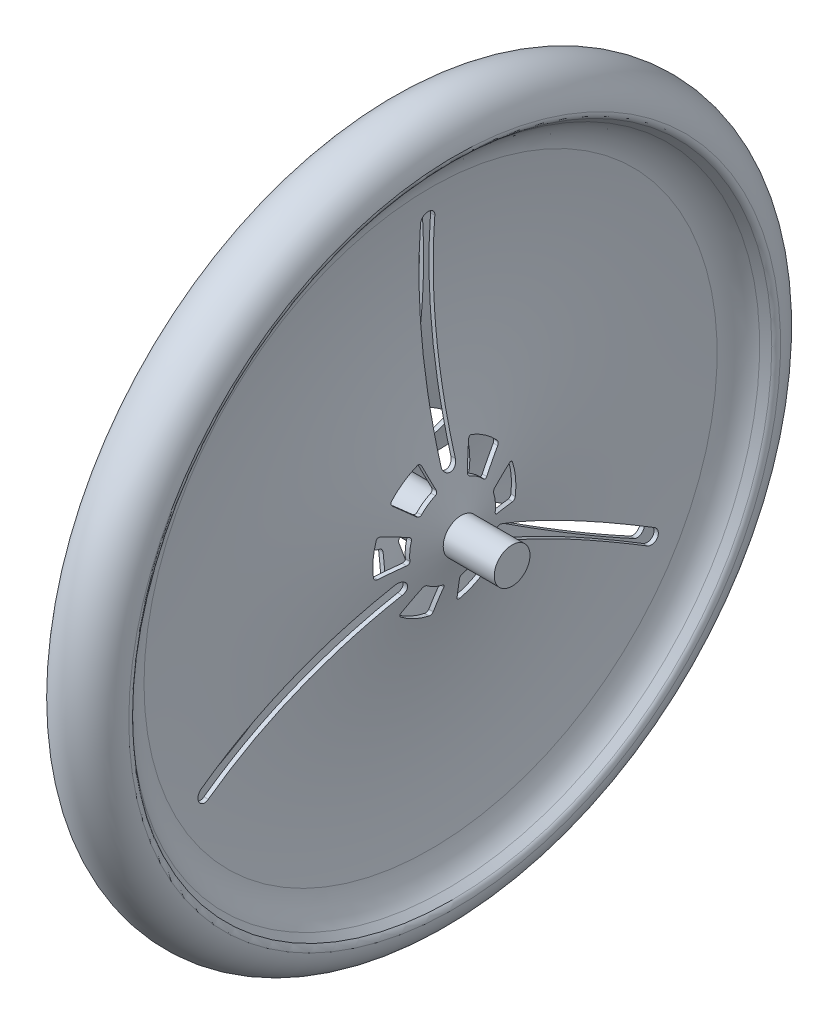
from build123d import *

# Parameters (mm, degrees)
SHELL2_T                       = 3
CUT_EXTRUDE1_REACH             = 356.77
CUT_EXTRUDE1_DIRECTION_2_REACH = 356.77
SKETCH3_R                      = 12.5
BOSS_EXTRUDE1_DEPTH            = 65


with BuildPart() as part:
    # Sketch1 → Revolve1 (revolve)
    with BuildSketch(Plane.XY):
        with BuildLine():
            Line((23.089545139, 223.396938031), (18.4881994, 219.535950518))
            ThreePointArc((18.4881994, 219.535950518), (11.430058579, 210.911190634), (8.007194137, 200.305162445))
            ThreePointArc((8.007194137, 200.305162445), (7.428056518, 105.123603262), (29.353674586, 12.5))
            Line((29.353674586, 12.5), (-29.353674586, 12.5))
            ThreePointArc((-29.353674586, 12.5), (-7.428056518, 105.123603262), (-8.007194137, 200.305162445))
            ThreePointArc((-8.007194137, 200.305162445), (-11.430058579, 210.911190634), (-18.4881994, 219.535950518))
            Line((-18.4881994, 219.535950518), (-23.089545139, 223.396938031))
            ThreePointArc((-23.089545139, 223.396938031), (-24.517932593, 225.37006199), (-24.844508864, 227.783950308))
            ThreePointArc((-24.844508864, 227.783950308), (0, 250), (24.844508864, 227.783950308))
            ThreePointArc((24.844508864, 227.783950308), (24.517932593, 225.37006199), (23.089545139, 223.396938031))
        make_face()
    revolve(axis=Axis((0, 0, 0), (1, 0, 0)))

    # Shell2 (no face opened: a closed hollow body)
    add(offset(amount=-SHELL2_T, mode=Mode.PRIVATE), mode=Mode.SUBTRACT)

    # Sketch2 → Cut-Extrude1 (cut, up to next)
    with BuildSketch(Plane(origin=(0, 0, 0), x_dir=(0, 0, -1), z_dir=(1, 0, 0)), mode=Mode.PRIVATE) as cut_extrude1_sk1:
        with BuildLine():
            Line((-5, 40), (-5, 180))
            ThreePointArc((-5, 180), (0, 185), (5, 180))
            Line((5, 180), (5, 40))
            ThreePointArc((5, 40), (0, 35), (-5, 40))
        make_face()
    cut_extrude1_tool1 = extrude(cut_extrude1_sk1.sketch, amount=CUT_EXTRUDE1_REACH, mode=Mode.PRIVATE) & part.part
    # Sketch2 → Cut-Extrude1 (cut, up to next)
    with BuildSketch(Plane(origin=(0, 0, 0), x_dir=(0, 0, -1), z_dir=(1, 0, 0)), mode=Mode.PRIVATE) as cut_extrude1_sk2:
        with BuildLine():
            Line((32.141016151, -24.330127019), (153.384572681, -94.330127019))
            ThreePointArc((153.384572681, -94.330127019), (160.2146997, -92.5), (158.384572681, -85.669872981))
            Line((158.384572681, -85.669872981), (37.141016151, -15.669872981))
            ThreePointArc((37.141016151, -15.669872981), (30.310889132, -17.5), (32.141016151, -24.330127019))
        make_face()
    cut_extrude1_tool2 = extrude(cut_extrude1_sk2.sketch, amount=CUT_EXTRUDE1_REACH, mode=Mode.PRIVATE) & part.part
    # Sketch2 → Cut-Extrude1 (cut, up to next)
    with BuildSketch(Plane(origin=(0, 0, 0), x_dir=(0, 0, -1), z_dir=(1, 0, 0)), mode=Mode.PRIVATE) as cut_extrude1_sk3:
        with BuildLine():
            Line((-37.141016151, -15.669872981), (-158.384572681, -85.669872981))
            ThreePointArc((-158.384572681, -85.669872981), (-160.2146997, -92.5), (-153.384572681, -94.330127019))
            Line((-153.384572681, -94.330127019), (-32.141016151, -24.330127019))
            ThreePointArc((-32.141016151, -24.330127019), (-30.310889132, -17.5), (-37.141016151, -15.669872981))
        make_face()
    cut_extrude1_tool3 = extrude(cut_extrude1_sk3.sketch, amount=CUT_EXTRUDE1_REACH, mode=Mode.PRIVATE) & part.part
    # Sketch2 → Cut-Extrude1 (cut, up to next)
    with BuildSketch(Plane(origin=(0, 0, 0), x_dir=(0, 0, -1), z_dir=(1, 0, 0)), mode=Mode.PRIVATE) as cut_extrude1_sk4:
        with BuildLine():
            Line((10.923247411, 30.01137561), (16.40270985, 45.06607493))
            ThreePointArc((16.40270985, 45.06607493), (17.474813121, 46.21186956), (19.043849053, 46.231286087))
            ThreePointArc((19.043849053, 46.231286087), (28.678821818, 40.957602214), (36.929818402, 33.70739552))
            ThreePointArc((36.929818402, 33.70739552), (37.448214729, 32.22634319), (36.738200886, 30.827010813))
            Line((36.738200886, 30.827010813), (24.465497555, 20.528989975))
            ThreePointArc((24.465497555, 20.528989975), (23.067988689, 20.064213603), (21.73117719, 20.682261432))
            ThreePointArc((21.73117719, 20.682261432), (17.207293091, 24.574561329), (12.002468112, 27.494376865))
            ThreePointArc((12.002468112, 27.494376865), (10.964476667, 28.53918396), (10.923247411, 30.01137561))
        make_face()
    cut_extrude1_tool4 = extrude(cut_extrude1_sk4.sketch, amount=CUT_EXTRUDE1_REACH, mode=Mode.PRIVATE) & part.part
    # Sketch2 → Cut-Extrude1 (cut, up to next)
    with BuildSketch(Plane(origin=(0, 0, 0), x_dir=(0, 0, -1), z_dir=(1, 0, 0)), mode=Mode.PRIVATE) as cut_extrude1_sk5:
        with BuildLine():
            Line((31.452237386, -5.545878055), (47.229720663, -8.327874044))
            ThreePointArc((47.229720663, -8.327874044), (48.758059556, -7.97230269), (49.559392727, -6.623185977))
            ThreePointArc((49.559392727, -6.623185977), (49.809734905, 4.357787137), (47.656370017, 15.128463133))
            ThreePointArc((47.656370017, 15.128463133), (46.632939238, 16.317933687), (45.06607493, 16.40270985))
            Line((45.06607493, 16.40270985), (30.01137561, 10.923247411))
            ThreePointArc((30.01137561, 10.923247411), (28.910113032, 9.945357418), (28.776952403, 8.478620784))
            ThreePointArc((28.776952403, 8.478620784), (29.885840943, 2.614672282), (29.812062883, -3.35274614))
            ThreePointArc((29.812062883, -3.35274614), (30.197896646, -4.774076647), (31.452237386, -5.545878055))
        make_face()
    cut_extrude1_tool5 = extrude(cut_extrude1_sk5.sketch, amount=CUT_EXTRUDE1_REACH, mode=Mode.PRIVATE) & part.part
    # Sketch2 → Cut-Extrude1 (cut, up to next)
    with BuildSketch(Plane(origin=(0, 0, 0), x_dir=(0, 0, -1), z_dir=(1, 0, 0)), mode=Mode.PRIVATE) as cut_extrude1_sk6:
        with BuildLine():
            Line((5.545878055, -31.452237386), (8.327874044, -47.229720663))
            ThreePointArc((8.327874044, -47.229720663), (9.184724509, -48.544276877), (10.726551615, -48.835858654))
            ThreePointArc((10.726551615, -48.835858654), (21.130913087, -45.315389352), (30.515543674, -39.608100109))
            ThreePointArc((30.515543674, -39.608100109), (31.283246434, -38.239566869), (30.827010813, -36.738200886))
            Line((30.827010813, -36.738200886), (20.528989975, -24.465497555))
            ThreePointArc((20.528989975, -24.465497555), (19.233419979, -23.765107313), (17.809594771, -24.141630726))
            ThreePointArc((17.809594771, -24.141630726), (12.678547852, -27.189233611), (7.045775213, -29.160882216))
            ThreePointArc((7.045775213, -29.160882216), (5.842124343, -30.009571021), (5.545878055, -31.452237386))
        make_face()
    cut_extrude1_tool6 = extrude(cut_extrude1_sk6.sketch, amount=CUT_EXTRUDE1_REACH, mode=Mode.PRIVATE) & part.part
    # Sketch2 → Cut-Extrude1 (cut, up to next)
    with BuildSketch(Plane(origin=(0, 0, 0), x_dir=(0, 0, -1), z_dir=(1, 0, 0)), mode=Mode.PRIVATE) as cut_extrude1_sk7:
        with BuildLine():
            Line((-20.528989975, -24.465497555), (-30.827010813, -36.738200886))
            ThreePointArc((-30.827010813, -36.738200886), (-31.283246434, -38.239566869), (-30.515543674, -39.608100109))
            ThreePointArc((-30.515543674, -39.608100109), (-21.130913087, -45.315389352), (-10.726551615, -48.835858654))
            ThreePointArc((-10.726551615, -48.835858654), (-9.184724509, -48.544276877), (-8.327874044, -47.229720663))
            Line((-8.327874044, -47.229720663), (-5.545878055, -31.452237386))
            ThreePointArc((-5.545878055, -31.452237386), (-5.842124343, -30.009571021), (-7.045775213, -29.160882216))
            ThreePointArc((-7.045775213, -29.160882216), (-12.678547852, -27.189233611), (-17.809594771, -24.141630726))
            ThreePointArc((-17.809594771, -24.141630726), (-19.233419979, -23.765107313), (-20.528989975, -24.465497555))
        make_face()
    cut_extrude1_tool7 = extrude(cut_extrude1_sk7.sketch, amount=CUT_EXTRUDE1_REACH, mode=Mode.PRIVATE) & part.part
    # Sketch2 → Cut-Extrude1 (cut, up to next)
    with BuildSketch(Plane(origin=(0, 0, 0), x_dir=(0, 0, -1), z_dir=(1, 0, 0)), mode=Mode.PRIVATE) as cut_extrude1_sk8:
        with BuildLine():
            Line((-30.01137561, 10.923247411), (-45.06607493, 16.40270985))
            ThreePointArc((-45.06607493, 16.40270985), (-46.632939238, 16.317933687), (-47.656370017, 15.128463133))
            ThreePointArc((-47.656370017, 15.128463133), (-49.809734905, 4.357787137), (-49.559392727, -6.623185977))
            ThreePointArc((-49.559392727, -6.623185977), (-48.758059556, -7.97230269), (-47.229720663, -8.327874044))
            Line((-47.229720663, -8.327874044), (-31.452237386, -5.545878055))
            ThreePointArc((-31.452237386, -5.545878055), (-30.197896646, -4.774076647), (-29.812062883, -3.35274614))
            ThreePointArc((-29.812062883, -3.35274614), (-29.885840943, 2.614672282), (-28.776952403, 8.478620784))
            ThreePointArc((-28.776952403, 8.478620784), (-28.910113032, 9.945357418), (-30.01137561, 10.923247411))
        make_face()
    cut_extrude1_tool8 = extrude(cut_extrude1_sk8.sketch, amount=CUT_EXTRUDE1_REACH, mode=Mode.PRIVATE) & part.part
    # Sketch2 → Cut-Extrude1 (cut, up to next)
    with BuildSketch(Plane(origin=(0, 0, 0), x_dir=(0, 0, -1), z_dir=(1, 0, 0)), mode=Mode.PRIVATE) as cut_extrude1_sk9:
        with BuildLine():
            Line((-10.923247411, 30.01137561), (-16.40270985, 45.06607493))
            ThreePointArc((-16.40270985, 45.06607493), (-17.474813121, 46.21186956), (-19.043849053, 46.231286087))
            ThreePointArc((-19.043849053, 46.231286087), (-28.678821818, 40.957602214), (-36.929818402, 33.70739552))
            ThreePointArc((-36.929818402, 33.70739552), (-37.448214729, 32.22634319), (-36.738200886, 30.827010813))
            Line((-36.738200886, 30.827010813), (-24.465497555, 20.528989975))
            ThreePointArc((-24.465497555, 20.528989975), (-23.067988689, 20.064213603), (-21.73117719, 20.682261432))
            ThreePointArc((-21.73117719, 20.682261432), (-17.207293091, 24.574561329), (-12.002468112, 27.494376865))
            ThreePointArc((-12.002468112, 27.494376865), (-10.964476667, 28.53918396), (-10.923247411, 30.01137561))
        make_face()
    cut_extrude1_tool9 = extrude(cut_extrude1_sk9.sketch, amount=CUT_EXTRUDE1_REACH, mode=Mode.PRIVATE) & part.part
    add(cut_extrude1_tool1.solids().sort_by_distance((0, 110, 0))[0], mode=Mode.SUBTRACT)
    add(cut_extrude1_tool2.solids().sort_by_distance((0, -55, -95.262794))[0], mode=Mode.SUBTRACT)
    add(cut_extrude1_tool3.solids().sort_by_distance((0, -55, 95.262794))[0], mode=Mode.SUBTRACT)
    add(cut_extrude1_tool4.solids().sort_by_distance((0, 33.073811, -23.158532))[0], mode=Mode.SUBTRACT)
    add(cut_extrude1_tool5.solids().sort_by_distance((0, 3.518971, -40.222026))[0], mode=Mode.SUBTRACT)
    add(cut_extrude1_tool6.solids().sort_by_distance((0, -36.592782, -17.063495))[0], mode=Mode.SUBTRACT)
    add(cut_extrude1_tool7.solids().sort_by_distance((0, -36.592782, 17.063495))[0], mode=Mode.SUBTRACT)
    add(cut_extrude1_tool8.solids().sort_by_distance((0, 3.518971, 40.222026))[0], mode=Mode.SUBTRACT)
    add(cut_extrude1_tool9.solids().sort_by_distance((0, 33.073811, 23.158532))[0], mode=Mode.SUBTRACT)

    # Sketch2 → Cut-Extrude1 direction 2 (cut, up to next)
    with BuildSketch(Plane(origin=(0, 0, 0), x_dir=(0, 0, -1), z_dir=(1, 0, 0)), mode=Mode.PRIVATE) as cut_extrude1_direction_2_sk1:
        with BuildLine():
            Line((-5, 40), (-5, 180))
            ThreePointArc((-5, 180), (0, 185), (5, 180))
            Line((5, 180), (5, 40))
            ThreePointArc((5, 40), (0, 35), (-5, 40))
        make_face()
    cut_extrude1_direction_2_tool1 = extrude(cut_extrude1_direction_2_sk1.sketch, amount=-CUT_EXTRUDE1_DIRECTION_2_REACH, mode=Mode.PRIVATE) & part.part
    # Sketch2 → Cut-Extrude1 direction 2 (cut, up to next)
    with BuildSketch(Plane(origin=(0, 0, 0), x_dir=(0, 0, -1), z_dir=(1, 0, 0)), mode=Mode.PRIVATE) as cut_extrude1_direction_2_sk2:
        with BuildLine():
            Line((32.141016151, -24.330127019), (153.384572681, -94.330127019))
            ThreePointArc((153.384572681, -94.330127019), (160.2146997, -92.5), (158.384572681, -85.669872981))
            Line((158.384572681, -85.669872981), (37.141016151, -15.669872981))
            ThreePointArc((37.141016151, -15.669872981), (30.310889132, -17.5), (32.141016151, -24.330127019))
        make_face()
    cut_extrude1_direction_2_tool2 = extrude(cut_extrude1_direction_2_sk2.sketch, amount=-CUT_EXTRUDE1_DIRECTION_2_REACH, mode=Mode.PRIVATE) & part.part
    # Sketch2 → Cut-Extrude1 direction 2 (cut, up to next)
    with BuildSketch(Plane(origin=(0, 0, 0), x_dir=(0, 0, -1), z_dir=(1, 0, 0)), mode=Mode.PRIVATE) as cut_extrude1_direction_2_sk3:
        with BuildLine():
            Line((-37.141016151, -15.669872981), (-158.384572681, -85.669872981))
            ThreePointArc((-158.384572681, -85.669872981), (-160.2146997, -92.5), (-153.384572681, -94.330127019))
            Line((-153.384572681, -94.330127019), (-32.141016151, -24.330127019))
            ThreePointArc((-32.141016151, -24.330127019), (-30.310889132, -17.5), (-37.141016151, -15.669872981))
        make_face()
    cut_extrude1_direction_2_tool3 = extrude(cut_extrude1_direction_2_sk3.sketch, amount=-CUT_EXTRUDE1_DIRECTION_2_REACH, mode=Mode.PRIVATE) & part.part
    # Sketch2 → Cut-Extrude1 direction 2 (cut, up to next)
    with BuildSketch(Plane(origin=(0, 0, 0), x_dir=(0, 0, -1), z_dir=(1, 0, 0)), mode=Mode.PRIVATE) as cut_extrude1_direction_2_sk4:
        with BuildLine():
            Line((10.923247411, 30.01137561), (16.40270985, 45.06607493))
            ThreePointArc((16.40270985, 45.06607493), (17.474813121, 46.21186956), (19.043849053, 46.231286087))
            ThreePointArc((19.043849053, 46.231286087), (28.678821818, 40.957602214), (36.929818402, 33.70739552))
            ThreePointArc((36.929818402, 33.70739552), (37.448214729, 32.22634319), (36.738200886, 30.827010813))
            Line((36.738200886, 30.827010813), (24.465497555, 20.528989975))
            ThreePointArc((24.465497555, 20.528989975), (23.067988689, 20.064213603), (21.73117719, 20.682261432))
            ThreePointArc((21.73117719, 20.682261432), (17.207293091, 24.574561329), (12.002468112, 27.494376865))
            ThreePointArc((12.002468112, 27.494376865), (10.964476667, 28.53918396), (10.923247411, 30.01137561))
        make_face()
    cut_extrude1_direction_2_tool4 = extrude(cut_extrude1_direction_2_sk4.sketch, amount=-CUT_EXTRUDE1_DIRECTION_2_REACH, mode=Mode.PRIVATE) & part.part
    # Sketch2 → Cut-Extrude1 direction 2 (cut, up to next)
    with BuildSketch(Plane(origin=(0, 0, 0), x_dir=(0, 0, -1), z_dir=(1, 0, 0)), mode=Mode.PRIVATE) as cut_extrude1_direction_2_sk5:
        with BuildLine():
            Line((31.452237386, -5.545878055), (47.229720663, -8.327874044))
            ThreePointArc((47.229720663, -8.327874044), (48.758059556, -7.97230269), (49.559392727, -6.623185977))
            ThreePointArc((49.559392727, -6.623185977), (49.809734905, 4.357787137), (47.656370017, 15.128463133))
            ThreePointArc((47.656370017, 15.128463133), (46.632939238, 16.317933687), (45.06607493, 16.40270985))
            Line((45.06607493, 16.40270985), (30.01137561, 10.923247411))
            ThreePointArc((30.01137561, 10.923247411), (28.910113032, 9.945357418), (28.776952403, 8.478620784))
            ThreePointArc((28.776952403, 8.478620784), (29.885840943, 2.614672282), (29.812062883, -3.35274614))
            ThreePointArc((29.812062883, -3.35274614), (30.197896646, -4.774076647), (31.452237386, -5.545878055))
        make_face()
    cut_extrude1_direction_2_tool5 = extrude(cut_extrude1_direction_2_sk5.sketch, amount=-CUT_EXTRUDE1_DIRECTION_2_REACH, mode=Mode.PRIVATE) & part.part
    # Sketch2 → Cut-Extrude1 direction 2 (cut, up to next)
    with BuildSketch(Plane(origin=(0, 0, 0), x_dir=(0, 0, -1), z_dir=(1, 0, 0)), mode=Mode.PRIVATE) as cut_extrude1_direction_2_sk6:
        with BuildLine():
            Line((5.545878055, -31.452237386), (8.327874044, -47.229720663))
            ThreePointArc((8.327874044, -47.229720663), (9.184724509, -48.544276877), (10.726551615, -48.835858654))
            ThreePointArc((10.726551615, -48.835858654), (21.130913087, -45.315389352), (30.515543674, -39.608100109))
            ThreePointArc((30.515543674, -39.608100109), (31.283246434, -38.239566869), (30.827010813, -36.738200886))
            Line((30.827010813, -36.738200886), (20.528989975, -24.465497555))
            ThreePointArc((20.528989975, -24.465497555), (19.233419979, -23.765107313), (17.809594771, -24.141630726))
            ThreePointArc((17.809594771, -24.141630726), (12.678547852, -27.189233611), (7.045775213, -29.160882216))
            ThreePointArc((7.045775213, -29.160882216), (5.842124343, -30.009571021), (5.545878055, -31.452237386))
        make_face()
    cut_extrude1_direction_2_tool6 = extrude(cut_extrude1_direction_2_sk6.sketch, amount=-CUT_EXTRUDE1_DIRECTION_2_REACH, mode=Mode.PRIVATE) & part.part
    # Sketch2 → Cut-Extrude1 direction 2 (cut, up to next)
    with BuildSketch(Plane(origin=(0, 0, 0), x_dir=(0, 0, -1), z_dir=(1, 0, 0)), mode=Mode.PRIVATE) as cut_extrude1_direction_2_sk7:
        with BuildLine():
            Line((-20.528989975, -24.465497555), (-30.827010813, -36.738200886))
            ThreePointArc((-30.827010813, -36.738200886), (-31.283246434, -38.239566869), (-30.515543674, -39.608100109))
            ThreePointArc((-30.515543674, -39.608100109), (-21.130913087, -45.315389352), (-10.726551615, -48.835858654))
            ThreePointArc((-10.726551615, -48.835858654), (-9.184724509, -48.544276877), (-8.327874044, -47.229720663))
            Line((-8.327874044, -47.229720663), (-5.545878055, -31.452237386))
            ThreePointArc((-5.545878055, -31.452237386), (-5.842124343, -30.009571021), (-7.045775213, -29.160882216))
            ThreePointArc((-7.045775213, -29.160882216), (-12.678547852, -27.189233611), (-17.809594771, -24.141630726))
            ThreePointArc((-17.809594771, -24.141630726), (-19.233419979, -23.765107313), (-20.528989975, -24.465497555))
        make_face()
    cut_extrude1_direction_2_tool7 = extrude(cut_extrude1_direction_2_sk7.sketch, amount=-CUT_EXTRUDE1_DIRECTION_2_REACH, mode=Mode.PRIVATE) & part.part
    # Sketch2 → Cut-Extrude1 direction 2 (cut, up to next)
    with BuildSketch(Plane(origin=(0, 0, 0), x_dir=(0, 0, -1), z_dir=(1, 0, 0)), mode=Mode.PRIVATE) as cut_extrude1_direction_2_sk8:
        with BuildLine():
            Line((-30.01137561, 10.923247411), (-45.06607493, 16.40270985))
            ThreePointArc((-45.06607493, 16.40270985), (-46.632939238, 16.317933687), (-47.656370017, 15.128463133))
            ThreePointArc((-47.656370017, 15.128463133), (-49.809734905, 4.357787137), (-49.559392727, -6.623185977))
            ThreePointArc((-49.559392727, -6.623185977), (-48.758059556, -7.97230269), (-47.229720663, -8.327874044))
            Line((-47.229720663, -8.327874044), (-31.452237386, -5.545878055))
            ThreePointArc((-31.452237386, -5.545878055), (-30.197896646, -4.774076647), (-29.812062883, -3.35274614))
            ThreePointArc((-29.812062883, -3.35274614), (-29.885840943, 2.614672282), (-28.776952403, 8.478620784))
            ThreePointArc((-28.776952403, 8.478620784), (-28.910113032, 9.945357418), (-30.01137561, 10.923247411))
        make_face()
    cut_extrude1_direction_2_tool8 = extrude(cut_extrude1_direction_2_sk8.sketch, amount=-CUT_EXTRUDE1_DIRECTION_2_REACH, mode=Mode.PRIVATE) & part.part
    # Sketch2 → Cut-Extrude1 direction 2 (cut, up to next)
    with BuildSketch(Plane(origin=(0, 0, 0), x_dir=(0, 0, -1), z_dir=(1, 0, 0)), mode=Mode.PRIVATE) as cut_extrude1_direction_2_sk9:
        with BuildLine():
            Line((-10.923247411, 30.01137561), (-16.40270985, 45.06607493))
            ThreePointArc((-16.40270985, 45.06607493), (-17.474813121, 46.21186956), (-19.043849053, 46.231286087))
            ThreePointArc((-19.043849053, 46.231286087), (-28.678821818, 40.957602214), (-36.929818402, 33.70739552))
            ThreePointArc((-36.929818402, 33.70739552), (-37.448214729, 32.22634319), (-36.738200886, 30.827010813))
            Line((-36.738200886, 30.827010813), (-24.465497555, 20.528989975))
            ThreePointArc((-24.465497555, 20.528989975), (-23.067988689, 20.064213603), (-21.73117719, 20.682261432))
            ThreePointArc((-21.73117719, 20.682261432), (-17.207293091, 24.574561329), (-12.002468112, 27.494376865))
            ThreePointArc((-12.002468112, 27.494376865), (-10.964476667, 28.53918396), (-10.923247411, 30.01137561))
        make_face()
    cut_extrude1_direction_2_tool9 = extrude(cut_extrude1_direction_2_sk9.sketch, amount=-CUT_EXTRUDE1_DIRECTION_2_REACH, mode=Mode.PRIVATE) & part.part
    add(cut_extrude1_direction_2_tool1.solids().sort_by_distance((0, 110, 0))[0], mode=Mode.SUBTRACT)
    add(cut_extrude1_direction_2_tool2.solids().sort_by_distance((0, -55, -95.262794))[0], mode=Mode.SUBTRACT)
    add(cut_extrude1_direction_2_tool3.solids().sort_by_distance((0, -55, 95.262794))[0], mode=Mode.SUBTRACT)
    add(cut_extrude1_direction_2_tool4.solids().sort_by_distance((0, 33.073811, -23.158532))[0], mode=Mode.SUBTRACT)
    add(cut_extrude1_direction_2_tool5.solids().sort_by_distance((0, 3.518971, -40.222026))[0], mode=Mode.SUBTRACT)
    add(cut_extrude1_direction_2_tool6.solids().sort_by_distance((0, -36.592782, -17.063495))[0], mode=Mode.SUBTRACT)
    add(cut_extrude1_direction_2_tool7.solids().sort_by_distance((0, -36.592782, 17.063495))[0], mode=Mode.SUBTRACT)
    add(cut_extrude1_direction_2_tool8.solids().sort_by_distance((0, 3.518971, 40.222026))[0], mode=Mode.SUBTRACT)
    add(cut_extrude1_direction_2_tool9.solids().sort_by_distance((0, 33.073811, 23.158532))[0], mode=Mode.SUBTRACT)

    # Sketch3 → Boss-Extrude1 (add, symmetric)
    with BuildSketch(Plane(origin=(0, 0, 0), x_dir=(0, 0, -1), z_dir=(1, 0, 0))):
        Circle(SKETCH3_R)
    extrude(amount=BOSS_EXTRUDE1_DEPTH, both=True)


solid = part.part
